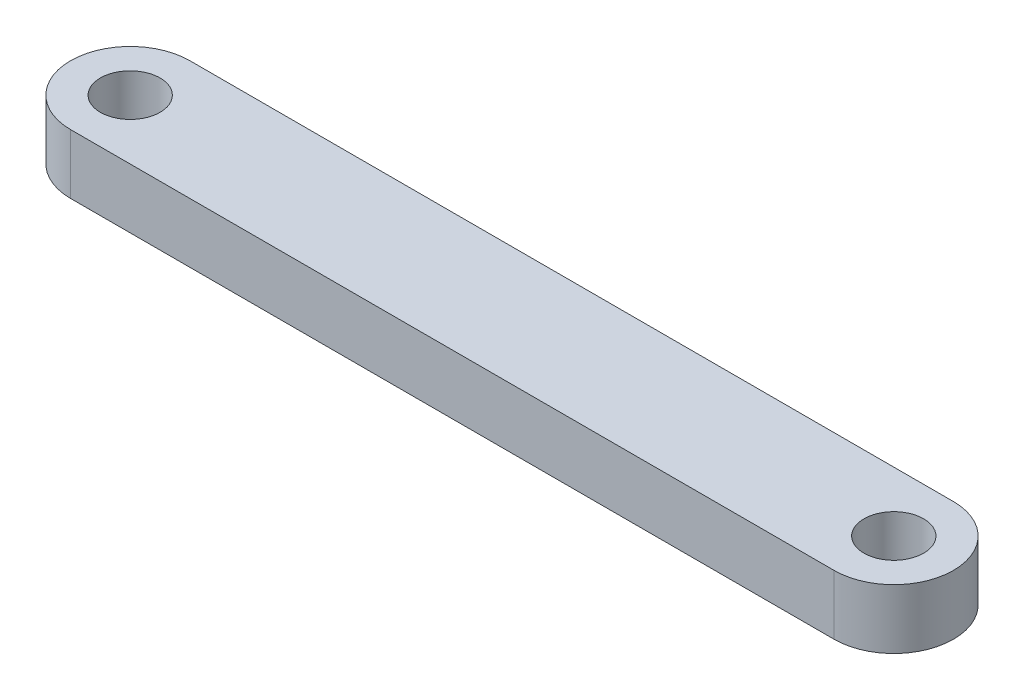
from build123d import *

# Parameters (mm, degrees)
SKETCH1_R           = 50
BOSS_EXTRUDE1_DEPTH = 50


with BuildPart() as part:
    # Sketch1 → Boss-Extrude1 (new, symmetric)
    with BuildSketch(Plane(origin=(0, 0, 0), x_dir=(1, 0, 0), z_dir=(0, 1, 0))):
        with BuildLine():
            Line((-640, 100), (640, 100))
            ThreePointArc((640, 100), (740, 0), (640, -100))
            Line((640, -100), (-640, -100))
            ThreePointArc((-640, -100), (-740, 0), (-640, 100))
        make_face()
        with Locations((-640, 0)):
            Circle(SKETCH1_R, mode=Mode.SUBTRACT)
        with Locations((640, 0)):
            Circle(SKETCH1_R, mode=Mode.SUBTRACT)
    extrude(amount=BOSS_EXTRUDE1_DEPTH, both=True)


solid = part.part
